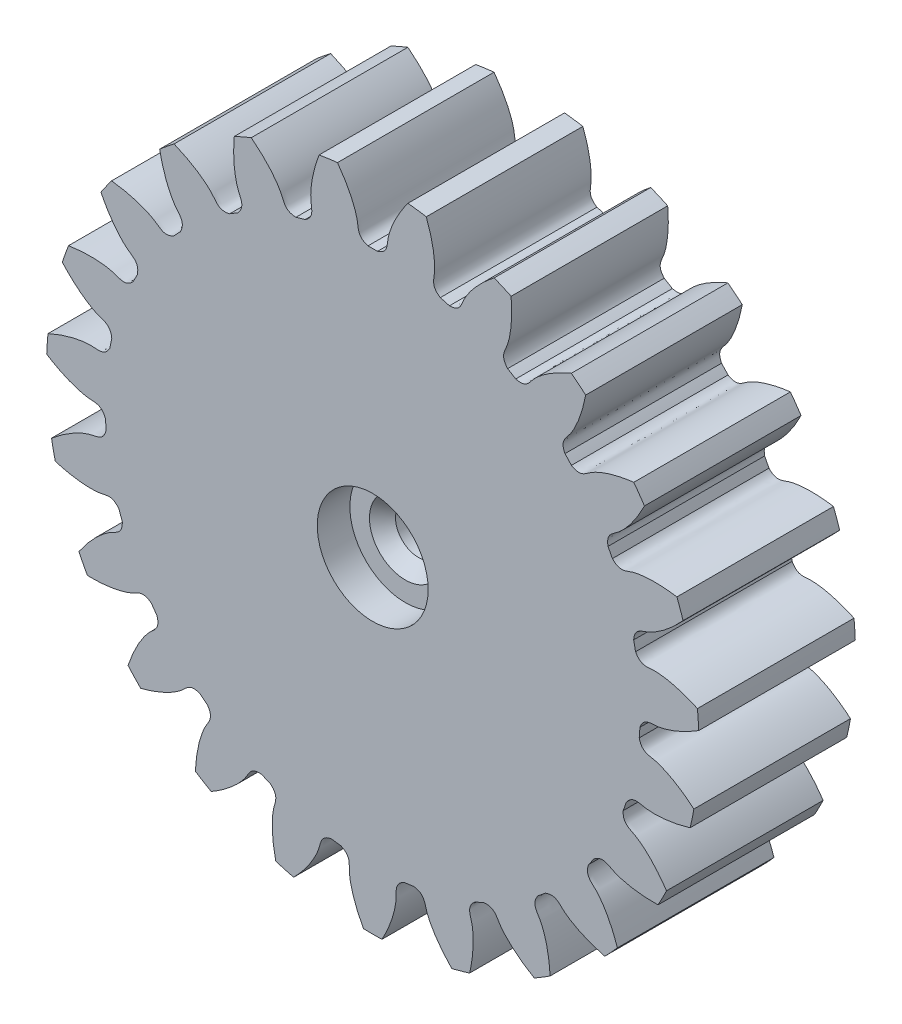
from build123d import *

# Parameters (mm, degrees)
SKETCH_1_R               = 25
EXTRUDE_1_DEPTH          = 12
CUT_EXTRUDE_1_DEPTH      = 38.336309405
PATTERN_CIRCULAR_1_COUNT = 23
SKETCH_4_R               = 1.75
CUT_EXTRUDE_2_DEPTH      = 38.322984198
CUT_EXTRUDE_4_DEPTH      = 2.5
SKETCH_7_R               = 4.25
CUT_EXTRUDE_5_DEPTH      = 2.5
SKETCH_8_R               = 5
CUT_EXTRUDE_6_DEPTH      = 3
FILLET_2_R               = 1
FILLET_4_R               = 2
CHAMFER_2_SIZE           = 1


with BuildPart() as part:
    # 草图1 → 凸台-拉伸1 (new body)
    with BuildSketch(Plane.XY):
        Circle(SKETCH_1_R)
    extrude(amount=EXTRUDE_1_DEPTH)

    # 草图2 → 切除-拉伸1 (cut, through all)
    with BuildSketch(Plane.XY):
        with BuildLine():
            ThreePointArc((0.362755305, 20.496790202), (0, 20.5), (-0.362755305, 20.496790202))
            add(Edge.make_bspline(
                [(-0.362755305, 20.496790202), (-1.155466972, 20.733525948), (-1.087520616, 21.26767434), (-1.185859869, 21.794351938), (-1.198995845, 21.857849297), (-1.215324159, 21.929500041), (-1.235163177, 22.009201186), (-1.258844493, 22.096836763), (-1.286691262, 22.192281901), (-1.319024726, 22.295401644), (-1.356161833, 22.406051438), (-1.398415633, 22.524077112), (-1.446094819, 22.649315017), (-1.499503533, 22.781592128), (-1.5589411, 22.920726165), (-1.624701785, 23.066525721), (-1.697074541, 23.218790386), (-1.776342776, 23.377310889), (-1.862784108, 23.541869241), (-1.956670134, 23.71223888), (-2.058266195, 23.888184833), (-2.167831155, 24.069463867), (-2.28561717, 24.255824664), (-2.411869476, 24.447007991), (-2.546826167, 24.642746874), (-2.690717991, 24.842766783), (-2.843768139, 25.046785824), (-3.006192046, 25.254514926), (-3.178197192, 25.465658044), (-3.359982914, 25.679912362), (-3.551740212, 25.8969685), (-3.753651576, 26.116510729), (-3.965890802, 26.338217186), (-4.188622824, 26.561760101), (-4.422003548, 26.786806019), (-4.666179691, 27.013016034), (-4.921288623, 27.240046023), (-5.18745824, 27.467546885), (-5.464806735, 27.695164787), (-5.854182413, 28.001900287), (-6.156580907, 28.225592313), (-6.363361531, 28.372391104)],
                knots=[0, 0, 0, 0, 0.147386897, 0.152959532, 0.159389495, 0.166676786, 0.174821406, 0.183823355, 0.193682632, 0.204399237, 0.21597317, 0.228404432, 0.241693023, 0.255838942, 0.270842189, 0.286702764, 0.303420668, 0.320995901, 0.339428462, 0.358718351, 0.378865568, 0.399870114, 0.421731989, 0.444451192, 0.468027723, 0.492461582, 0.517752771, 0.543901287, 0.570907132, 0.598770305, 0.627490807, 0.657068637, 0.687503795, 0.718796282, 0.750946098, 0.783953241, 0.817817713, 0.852539514, 0.888118643, 0.9245551, 1, 1, 1, 1], degree=3))
            ThreePointArc((-6.363361531, 28.372391104), (0, 29.077223852), (6.363361531, 28.372391104))
            add(Edge.make_bspline(
                [(0.362755305, 20.496790202), (1.155466972, 20.733525948), (1.087520616, 21.26767434), (1.185859869, 21.794351938), (1.198995845, 21.857849297), (1.215324159, 21.929500041), (1.235163177, 22.009201186), (1.258844493, 22.096836763), (1.286691262, 22.192281901), (1.319024726, 22.295401644), (1.356161833, 22.406051438), (1.398415633, 22.524077112), (1.446094819, 22.649315017), (1.499503533, 22.781592128), (1.5589411, 22.920726165), (1.624701785, 23.066525721), (1.697074541, 23.218790386), (1.776342776, 23.377310889), (1.862784108, 23.541869241), (1.956670134, 23.71223888), (2.058266195, 23.888184833), (2.167831155, 24.069463867), (2.28561717, 24.255824664), (2.411869476, 24.447007991), (2.546826167, 24.642746874), (2.690717991, 24.842766783), (2.843768139, 25.046785824), (3.006192046, 25.254514926), (3.178197192, 25.465658044), (3.359982914, 25.679912362), (3.551740212, 25.8969685), (3.753651576, 26.116510729), (3.965890802, 26.338217186), (4.188622824, 26.561760101), (4.422003548, 26.786806019), (4.666179691, 27.013016034), (4.921288623, 27.240046023), (5.18745824, 27.467546885), (5.464806735, 27.695164787), (5.854182413, 28.001900287), (6.156580907, 28.225592313), (6.363361531, 28.372391104)],
                knots=[0, 0, 0, 0, 0.147386897, 0.152959532, 0.159389495, 0.166676786, 0.174821406, 0.183823355, 0.193682632, 0.204399237, 0.21597317, 0.228404432, 0.241693023, 0.255838942, 0.270842189, 0.286702764, 0.303420668, 0.320995901, 0.339428462, 0.358718351, 0.378865568, 0.399870114, 0.421731989, 0.444451192, 0.468027723, 0.492461582, 0.517752771, 0.543901287, 0.570907132, 0.598770305, 0.627490807, 0.657068637, 0.687503795, 0.718796282, 0.750946098, 0.783953241, 0.817817713, 0.852539514, 0.888118643, 0.9245551, 1, 1, 1, 1], degree=3))
        make_face()
    cut_extrude_1 = extrude(amount=CUT_EXTRUDE_1_DEPTH, mode=Mode.SUBTRACT)

    # 阵列(圆周)1: 切除-拉伸1 ×23 about axis
    pattern_circular_1_axis = Axis((0, 0, -0.6), (0, 0, 1))
    for i in range(1, PATTERN_CIRCULAR_1_COUNT):
        add(cut_extrude_1.rotate(pattern_circular_1_axis, i * 360 / PATTERN_CIRCULAR_1_COUNT), mode=Mode.SUBTRACT)

    # 草图4 → 切除-拉伸2 (cut, through all)
    with BuildSketch(Plane(origin=(0, 0, 0), x_dir=(-1, 0, 0), z_dir=(0, 0, -1))):
        Circle(SKETCH_4_R)
    extrude(amount=-CUT_EXTRUDE_2_DEPTH, mode=Mode.SUBTRACT)

    # 草图5 → 切除-拉伸4 (cut)
    with BuildSketch(Plane(origin=(0, 0, 0), x_dir=(-1, 0, 0), z_dir=(0, 0, -1))):
        Polygon((-4.949747468, 4.949747468), (-4.949747468, 7.949747468), (-2.5, 20), (2.5, 20), (4.949747468, 7.949747468), (4.949747468, 4.949747468), (7.949747468, 4.949747468), (20, 2.5), (20, -2.5), (7.949747468, -4.949747468), (4.949747468, -4.949747468), (4.949747468, -7.949747468), (2.5, -20), (-2.5, -20), (-4.949747468, -7.949747468), (-4.949747468, -4.949747468), (-7.949747468, -4.949747468), (-20, -2.5), (-20, 2.5), (-7.949747468, 4.949747468), align=None)
    extrude(amount=-CUT_EXTRUDE_4_DEPTH, mode=Mode.SUBTRACT)

    # 草图7 → 切除-拉伸5 (cut)
    with BuildSketch(Plane.XY.offset(12)):
        Circle(SKETCH_7_R)
    extrude(amount=-CUT_EXTRUDE_5_DEPTH, mode=Mode.SUBTRACT)

    # 草图8 → 切除-拉伸6 (cut)
    with BuildSketch(Plane(origin=(0, 0, 2.5), x_dir=(-1, 0, 0), z_dir=(0, 0, -1))):
        Circle(SKETCH_8_R)
    extrude(amount=-CUT_EXTRUDE_6_DEPTH, mode=Mode.SUBTRACT)

    # 圆角2
    fillet_2_edges = [part.edges().sort_by_distance(p)[0] for p in [
        (-4.949747468, -4.949747468, 1.25),
        (4.949747468, -4.949747468, 1.25),
        (-4.949747468, 4.949747468, 1.25),
        (4.949747468, 4.949747468, 1.25),
        (5, 0, 2.5),
    ]]
    fillet(fillet_2_edges, radius=FILLET_2_R)

    # 圆角4
    fillet_4_edges = [part.edges().sort_by_distance(p)[0] for p in [
        (-20, 2.5, 1.25),
        (-20, -2.5, 1.25),
        (-2.5, -20, 1.25),
        (2.5, -20, 1.25),
        (20, -2.5, 1.25),
        (20, 2.5, 1.25),
        (-2.5, 20, 1.25),
        (2.5, 20, 1.25),
    ]]
    fillet(fillet_4_edges, radius=FILLET_4_R)

    # 倒角2
    chamfer_2_edges = [part.edges().sort_by_distance(p)[0] for p in [
        (1.75, 0, 9.5),
    ]]
    chamfer(chamfer_2_edges, length=CHAMFER_2_SIZE)


solid = part.part
